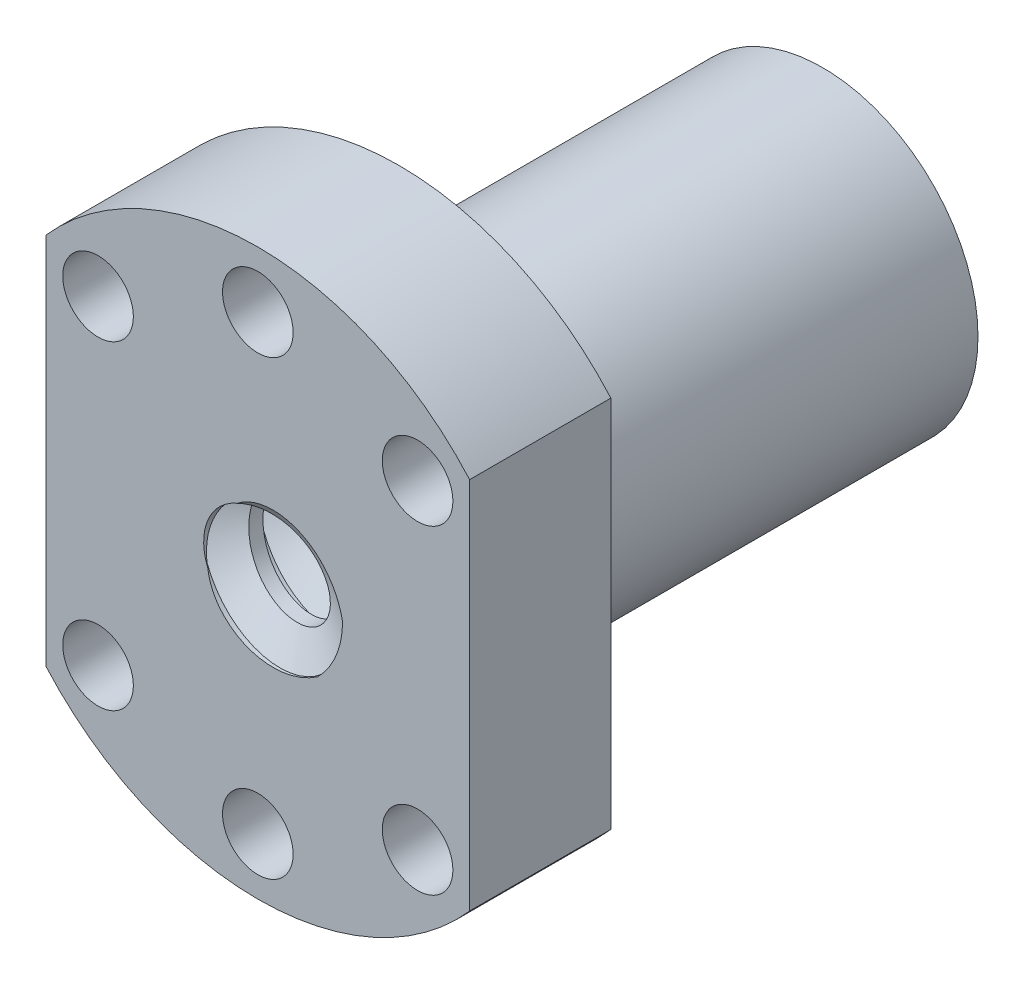
from build123d import *
from build123d.topology import SkipClean

# Parameters (mm, degrees)
SKETCH1_R           = 2.5
SKETCH1_R_2         = 6
BOSS_EXTRUDE1_DEPTH = 10
BOSS_EXTRUDE2_START = 30
SKETCH2_R           = 11
SKETCH2_R_2         = 6
BOSS_EXTRUDE2_DEPTH = 30
THREAD1_PITCH       = 4
THREAD1_FROM        = 6
THREAD1_TO          = 46


with BuildPart() as part:
    # Sketch1 → Boss-Extrude1 (new body)
    with BuildSketch(Plane.XY):
        with BuildLine():
            Line((-15, 13.228756555), (-15, -13.228756555))
            ThreePointArc((-15, -13.228756555), (0, -20), (15, -13.228756555))
            Line((15, -13.228756555), (15, 13.228756555))
            ThreePointArc((15, 13.228756555), (0, 20), (-15, 13.228756555))
        make_face()
        with Locations((-11.313708499, 11.313708499)):
            Circle(SKETCH1_R, mode=Mode.SUBTRACT)
        with Locations((0, 16)):
            Circle(SKETCH1_R, mode=Mode.SUBTRACT)
        with Locations((11.313708499, 11.313708499)):
            Circle(SKETCH1_R, mode=Mode.SUBTRACT)
        with Locations((11.313708499, -11.313708499)):
            Circle(SKETCH1_R, mode=Mode.SUBTRACT)
        with Locations((0, -16)):
            Circle(SKETCH1_R, mode=Mode.SUBTRACT)
        with Locations((-11.313708499, -11.313708499)):
            Circle(SKETCH1_R, mode=Mode.SUBTRACT)
        Circle(SKETCH1_R_2, mode=Mode.SUBTRACT)
    extrude(amount=BOSS_EXTRUDE1_DEPTH)

    # Sketch2 → Boss-Extrude2 (add)
    with SkipClean():  # the faces are left unmerged after this step: merging them gives an invalid solid
        with BuildSketch(Plane(origin=(0, 0, 0), x_dir=(-1, 0, 0), z_dir=(0, 0, -1)).offset(BOSS_EXTRUDE2_START)):
            with Locations(Location((0, 0, 0), (0, 0, 180))):
                Circle(SKETCH2_R)
            Circle(SKETCH2_R_2, mode=Mode.SUBTRACT)
        extrude(amount=-BOSS_EXTRUDE2_DEPTH)

    # Thread1: arcs per turn and ends read off the stored shape
    # Thread1: the profile of Thread Profile1 profile screwed along a right-hand helix through 11.5 turns, 12 arcs to a turn; built about Z, then put on its axis
    with SkipClean():  # the faces are left unmerged after this step: merging them gives an invalid solid
        thread1_z = Axis((0, 0, 0), (0, 0, 1))
        thread1_corners = [(6.0003, 0, -0.000173205), (6.0003, 0, 3.500173194), (3.8349365, 0, 2.249999995), (3.8349365, 0, 1.249999995)]
        with BuildLine(mode=Mode.PRIVATE) as thread1_profile:
            Line(thread1_corners[0], thread1_corners[1])
            Line(thread1_corners[1], thread1_corners[2])
            Line(thread1_corners[2], thread1_corners[3])
            Line(thread1_corners[3], thread1_corners[0])
        thread1_cap = Face(thread1_profile.wire())
        thread1_turn_angles = [0, 15, 30, 45, 60, 75, 90, 105, 120, 135, 150, 165, 180, 195, 210, 225, 240, 255, 270, 285, 300, 315, 330, 345, 360]
        thread1_turn_weights = [1, 0.9659258262890683, 1, 0.9659258262890683, 1, 0.9659258262890683, 1, 0.9659258262890683, 1, 0.9659258262890683, 1, 0.9659258262890683, 1, 0.9659258262890683, 1, 0.9659258262890683, 1, 0.9659258262890683, 1, 0.9659258262890683, 1, 0.9659258262890683, 1, 0.9659258262890683, 1]
        thread1_turn_rails = [Edge.make_bspline([Vector(p[0], p[1], 0).rotate(thread1_z, thread1_turn_angles[k]) / thread1_turn_weights[k] + Vector(0, 0, p[2] + THREAD1_PITCH * thread1_turn_angles[k] / 360) for k in range(25)], [0, 0, 0, 1, 1, 2, 2, 3, 3, 4, 4, 5, 5, 6, 6, 7, 7, 8, 8, 9, 9, 10, 10, 11, 11, 12, 12, 12], 2, thread1_turn_weights) for p in thread1_corners]
        thread1_turn_sides = [Face.make_surface_from_curves(thread1_turn_rails[p[0]], thread1_turn_rails[p[1]]) for p in [(0, 1), (1, 2), (2, 3), (3, 0)]]
        thread1_last_angles = [3960, 3975, 3990, 4005, 4020, 4035, 4050, 4065, 4080, 4095, 4110, 4125, 4140]
        thread1_last_weights = [1, 0.9659258262890683, 1, 0.9659258262890683, 1, 0.9659258262890683, 1, 0.9659258262890683, 1, 0.9659258262890683, 1, 0.9659258262890683, 1]
        thread1_last_rails = [Edge.make_bspline([Vector(p[0], p[1], 0).rotate(thread1_z, thread1_last_angles[k]) / thread1_last_weights[k] + Vector(0, 0, p[2] + THREAD1_PITCH * thread1_last_angles[k] / 360) for k in range(13)], [0, 0, 0, 1, 1, 2, 2, 3, 3, 4, 4, 5, 5, 6, 6, 6], 2, thread1_last_weights) for p in thread1_corners]
        thread1_last_sides = [Face.make_surface_from_curves(thread1_last_rails[p[0]], thread1_last_rails[p[1]]) for p in [(0, 1), (1, 2), (2, 3), (3, 0)]]
        thread1 = Plane(origin=(0, 0, 16), x_dir=(-1, 0, 0), z_dir=(0, 0, -1)) * split(split(Solid(Shell([*[p.moved(Location((0, 0, THREAD1_PITCH * i))) for i in range(11) for p in thread1_turn_sides], *thread1_last_sides, thread1_cap, thread1_cap.rotate(thread1_z, 4140).moved(Location((0, 0, THREAD1_PITCH * 4140 / 360)))])), bisect_by=Plane.XY.offset(THREAD1_FROM), keep=Keep.TOP, mode=Mode.PRIVATE), bisect_by=Plane.XY.offset(THREAD1_TO), keep=Keep.BOTTOM, mode=Mode.PRIVATE)
        add(thread1)
    add(part.part.scale(1), mode=Mode.REPLACE)  # the faces are merged on a copy


solid = part.part
